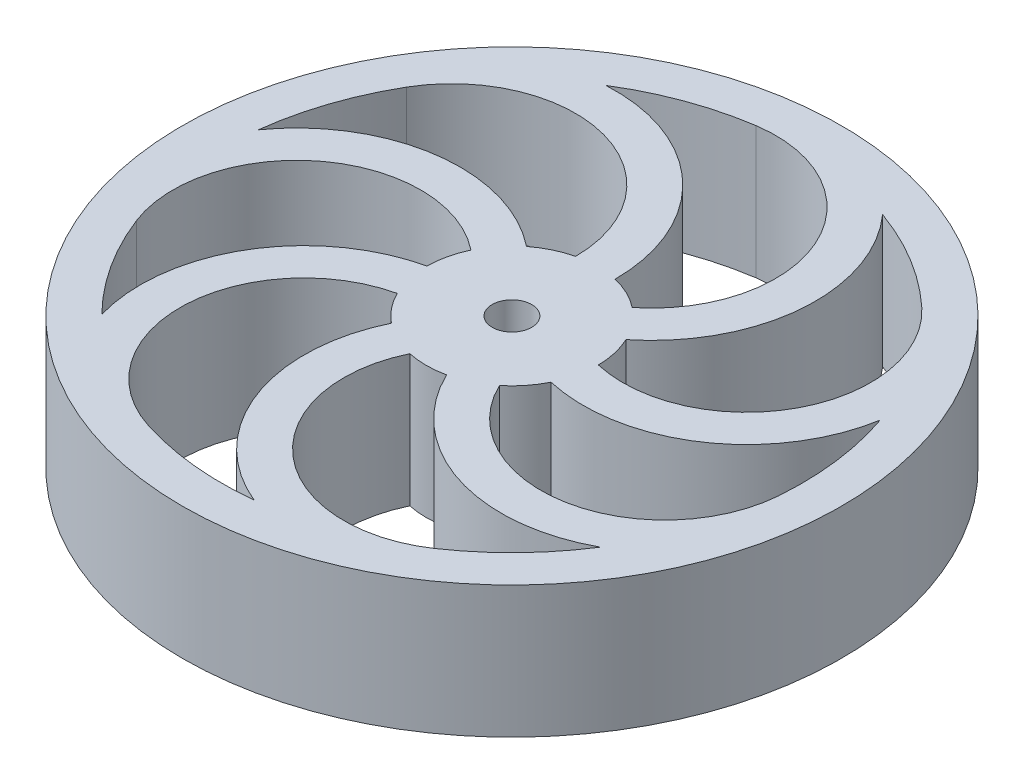
from build123d import *

# Parameters (mm, degrees)
BASE_REFERENCE_SKETCH_R       = 25
BASE_REFERENCE_SKETCH_R_2     = 1.5
BASE_WHEEL_EXTRUDE_DEPTH      = 10
SPOKES_CIRCULAR_PATTERN_COUNT = 7


with BuildPart() as part:
    # Base Reference Sketch → Base Wheel Extrude (new body)
    with BuildSketch(Plane(origin=(0, 0, 0), x_dir=(1, 0, 0), z_dir=(0, 1, 0))):
        Circle(BASE_REFERENCE_SKETCH_R)
        with BuildLine():
            ThreePointArc((-11.581663255, 18.704680598), (15.777248718, -15.332267376), (-19.028281976, 11.041942087))
            ThreePointArc((-19.028281976, 11.041942087), (-8.45631475, 15.40054572), (-1.5, 6.32455532))
            ThreePointArc((-1.5, 6.32455532), (0, -6.5), (1.5, 6.32455532))
            ThreePointArc((1.5, 6.32455532), (-2.376362363, 15.330073287), (-11.581663255, 18.704680598))
        make_face(mode=Mode.SUBTRACT)
        Circle(BASE_REFERENCE_SKETCH_R_2, mode=Mode.SUBTRACT)
    base_wheel_extrude = extrude(amount=BASE_WHEEL_EXTRUDE_DEPTH)

    # Spokes Circular Pattern: Base Wheel Extrude ×7 about axis
    spokes_circular_pattern_axis = Axis((0, 10, 0), (0, -1, 0))
    for i in range(1, SPOKES_CIRCULAR_PATTERN_COUNT):
        add(base_wheel_extrude.rotate(spokes_circular_pattern_axis, i * 360 / SPOKES_CIRCULAR_PATTERN_COUNT))


solid = part.part
